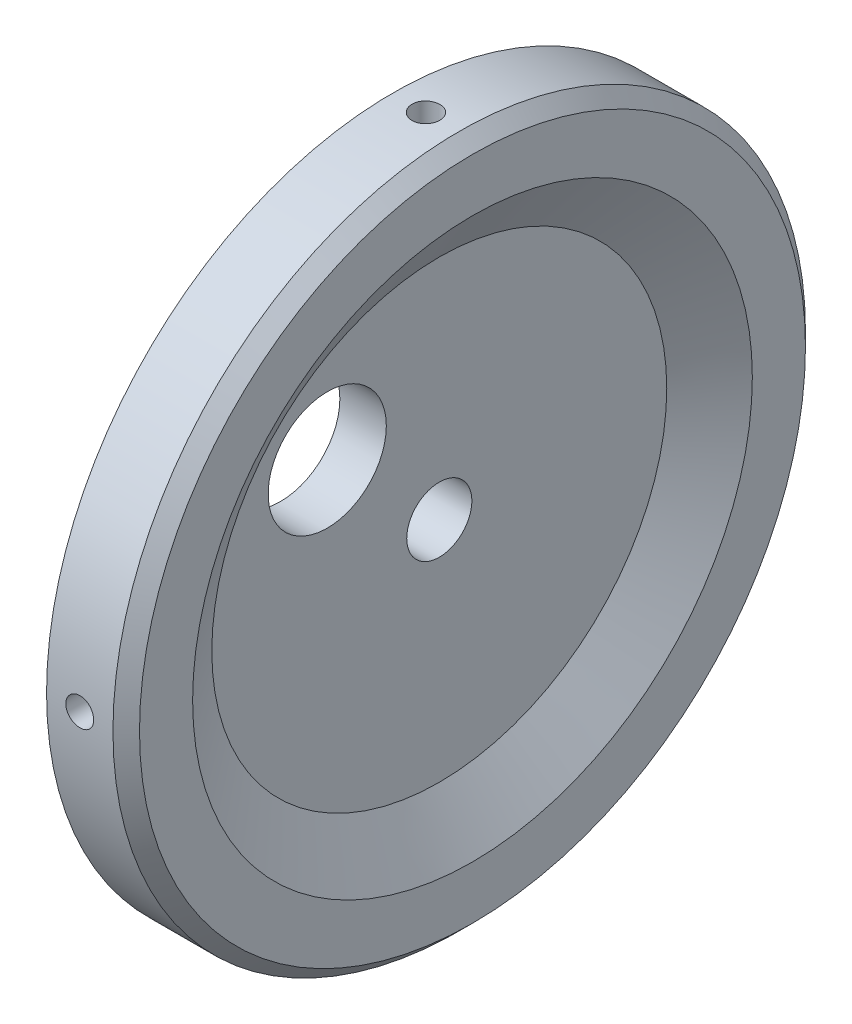
from build123d import *

# Parameters (mm, degrees)
CHAMFER1_SIZE      = 2
SKETCH3_R          = 8.9
CUT_EXTRUDE1_DEPTH = 10
CIRPATTERN1_COUNT  = 4


with BuildPart() as part:
    # Sketch1 → Revolve1 (revolve)
    with BuildSketch(Plane(origin=(0, 0, 0), x_dir=(1, 0, 0), z_dir=(0, 1, 0))):
        Polygon((0, 4.9022), (0, 52.15), (12, 52.15), (12, 42.15), (7, 34.26), (7, 4.9022), align=None)
    revolve(axis=Axis((0, 0, 0), (1, 0, 0)))

    # Chamfer1
    chamfer1_edges = [part.edges().sort_by_distance(p)[0] for p in [
        (12, 0, 52.15),
    ]]
    chamfer(chamfer1_edges, length=CHAMFER1_SIZE)

    # Sketch3 → Cut-Extrude1 (cut)
    with BuildSketch(Plane(origin=(7, 0, 0), x_dir=(0, 0, -1), z_dir=(1, 0, 0))):
        with Locations((-16.875192026, 16.225331227)):
            Circle(SKETCH3_R)
    extrude(amount=-CUT_EXTRUDE1_DEPTH, mode=Mode.SUBTRACT)

    # Sketch6 → M5x0.8 Tapped Hole1 (revolve, cut)
    with BuildSketch(Plane(origin=(5, 0, 52.15), x_dir=(0, -1, 0), z_dir=(1, 0, 0))):
        Polygon((0, 0), (0, 10.2618073), (2.1, 9), (2.1, 0), align=None)
    m5x0_8_tapped_hole1 = revolve(axis=Axis((5, 0, 58.5), (0, 0, -1)), mode=Mode.SUBTRACT)

    # CirPattern1: M5x0.8 Tapped Hole1 ×4 about axis
    cirpattern1_axis = Axis((0, 0, 0), (1, 0, 0))
    for i in range(1, CIRPATTERN1_COUNT):
        add(m5x0_8_tapped_hole1.rotate(cirpattern1_axis, i * 360 / CIRPATTERN1_COUNT), mode=Mode.SUBTRACT)


solid = part.part
